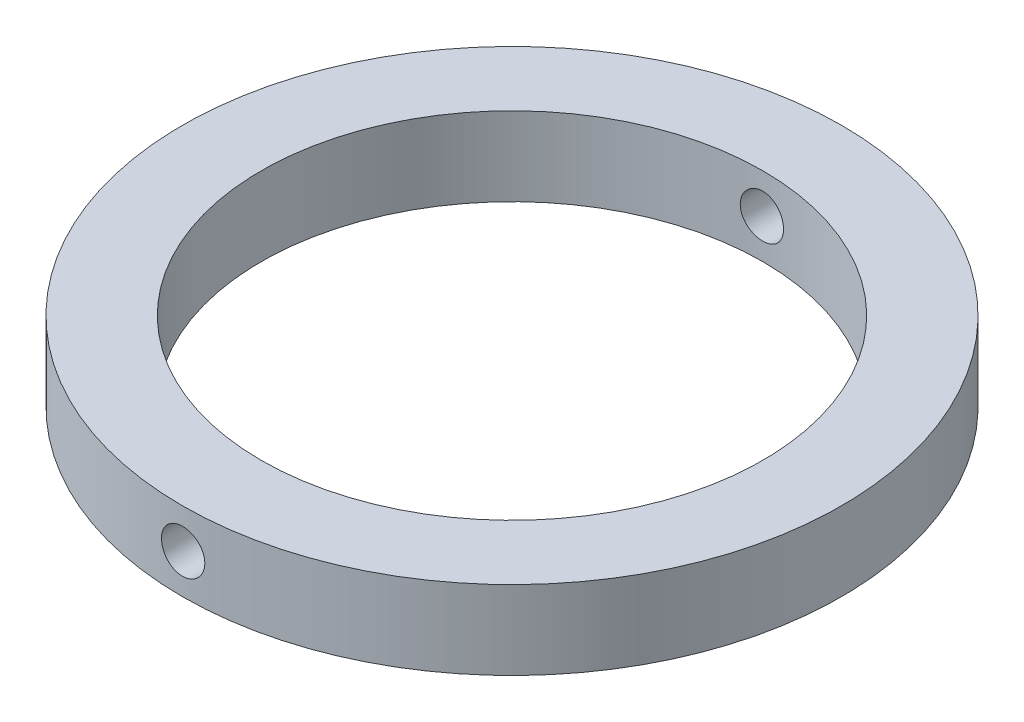
from build123d import *

# Parameters (mm, degrees)
SKETCH1_R               = 41.85
SKETCH1_R_2             = 31.85
BOSS_EXTRUDE1_DEPTH     = 10
CUT_EXTRUDE1_DEPTH      = 61.023703651
CUT_EXTRUDE1_DEPTH_BACK = 61.023703651
SKETCH5_R               = 2.75


with BuildPart() as part:
    # Sketch1 → Boss-Extrude1 (new body)
    with BuildSketch(Plane(origin=(0, 0, 0), x_dir=(1, 0, 0), z_dir=(0, 1, 0))):
        Circle(SKETCH1_R)
        Circle(SKETCH1_R_2, mode=Mode.SUBTRACT)
    extrude(amount=BOSS_EXTRUDE1_DEPTH)

    # Sketch5 → Cut-Extrude1 (cut, two sides: drawn at the far end of the back side and taken through both)
    with BuildSketch(Plane.XY.offset(-CUT_EXTRUDE1_DEPTH_BACK)):
        with Locations((0, 5)):
            Circle(SKETCH5_R)
    extrude(amount=CUT_EXTRUDE1_DEPTH + CUT_EXTRUDE1_DEPTH_BACK, mode=Mode.SUBTRACT)


solid = part.part
